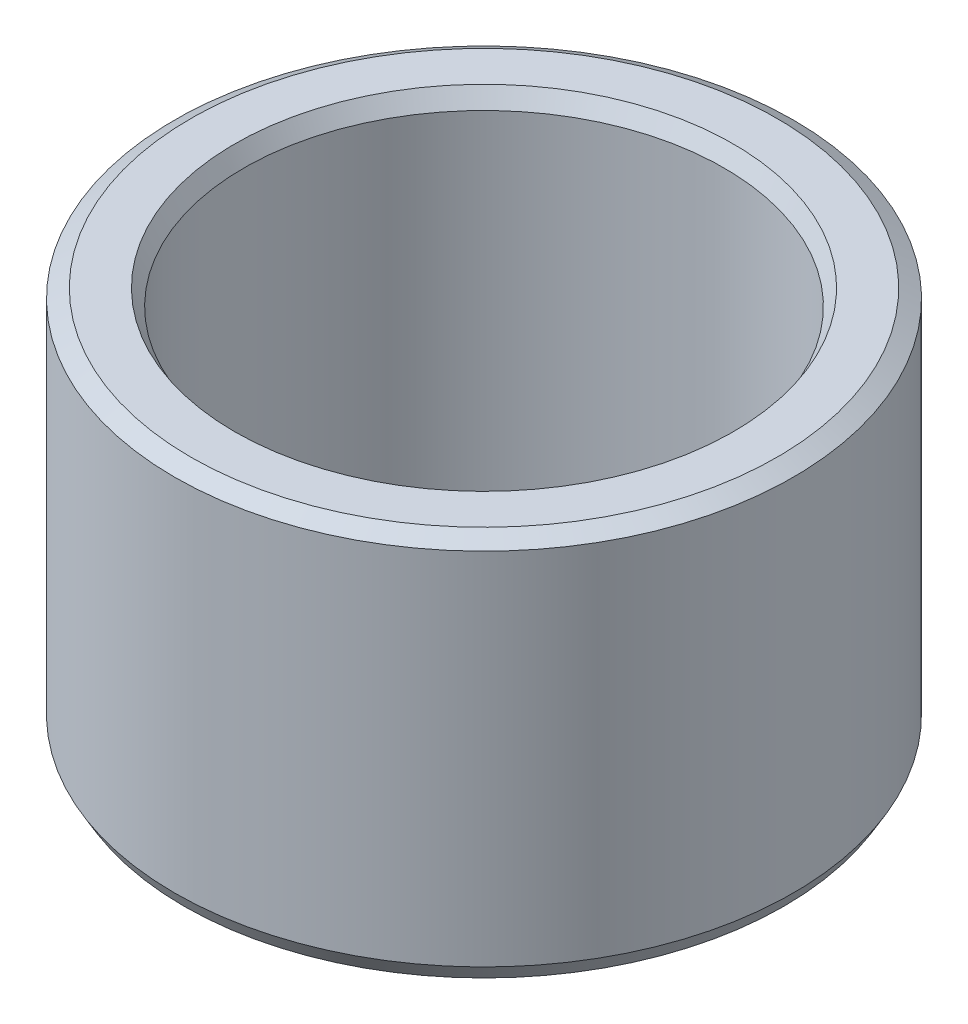
from build123d import *
from OCP.BRepFilletAPI import BRepFilletAPI_MakeChamfer

# Parameters (mm, degrees)
SKETCH1_R           = 35
BOSS_EXTRUDE1_DEPTH = 43.612355523
SKETCH2_R           = 27.151822112
CUT_EXTRUDE1_DEPTH  = 66.969974642
CHAMFER1_SIZE       = 1.05316868
CHAMFER1_SIZE2      = 1.824141664


with BuildPart() as part:
    # Sketch1 → Boss-Extrude1 (new body)
    with BuildSketch(Plane(origin=(0, 0, 0), x_dir=(1, 0, 0), z_dir=(0, 1, 0))):
        Circle(SKETCH1_R)
    extrude(amount=BOSS_EXTRUDE1_DEPTH)

    # Sketch2 → Cut-Extrude1 (cut, through all)
    with BuildSketch(Plane(origin=(0, 0, 0), x_dir=(1, 0, 0), z_dir=(0, 1, 0))):
        Circle(SKETCH2_R)
    extrude(amount=CUT_EXTRUDE1_DEPTH, mode=Mode.SUBTRACT)

    # Chamfer1: one chamfer whose edges measure the first distance from different faces: ONE call of the kernel's chamfer builder (chamfer() names one face for all edges)
    chamfer1_edges_1 = [part.edges().sort_by_distance(p)[0] for p in [
        (-27.151822112, 43.612355523, 0),
    ]]
    chamfer1_side_1 = [part.faces().sort_by_distance(p)[0] for p in [
        (-34.010050506, 43.612355523, 0),
    ]]
    chamfer1_edges_2 = [part.edges().sort_by_distance(p)[0] for p in [
        (-27.151822112, 0, 0),
    ]]
    chamfer1_side_2 = [part.faces().sort_by_distance(p)[0] for p in [
        (-27.151822112, 21.806177761, 0),
    ]]
    chamfer1_edges_3 = [part.edges().sort_by_distance(p)[0] for p in [
        (-35, 0, 0),
    ]]
    chamfer1_side_3 = [part.faces().sort_by_distance(p)[0] for p in [
        (-34.010050506, 0, 0),
    ]]
    chamfer1_edges_4 = [part.edges().sort_by_distance(p)[0] for p in [
        (-35, 43.612355523, 0),
    ]]
    chamfer1_side_4 = [part.faces().sort_by_distance(p)[0] for p in [
        (-35, 21.806177761, 0),
    ]]
    chamfer1 = BRepFilletAPI_MakeChamfer(part.part.solid().wrapped)
    for e in chamfer1_edges_1:
        chamfer1.Add(CHAMFER1_SIZE, CHAMFER1_SIZE2, e.wrapped, chamfer1_side_1[0].wrapped)  # the first distance lies on this face
    for e in chamfer1_edges_2:
        chamfer1.Add(CHAMFER1_SIZE, CHAMFER1_SIZE2, e.wrapped, chamfer1_side_2[0].wrapped)  # the first distance lies on this face
    for e in chamfer1_edges_3:
        chamfer1.Add(CHAMFER1_SIZE, CHAMFER1_SIZE2, e.wrapped, chamfer1_side_3[0].wrapped)  # the first distance lies on this face
    for e in chamfer1_edges_4:
        chamfer1.Add(CHAMFER1_SIZE, CHAMFER1_SIZE2, e.wrapped, chamfer1_side_4[0].wrapped)  # the first distance lies on this face
    add(Compound.cast(chamfer1.Shape()), mode=Mode.REPLACE)


solid = part.part
